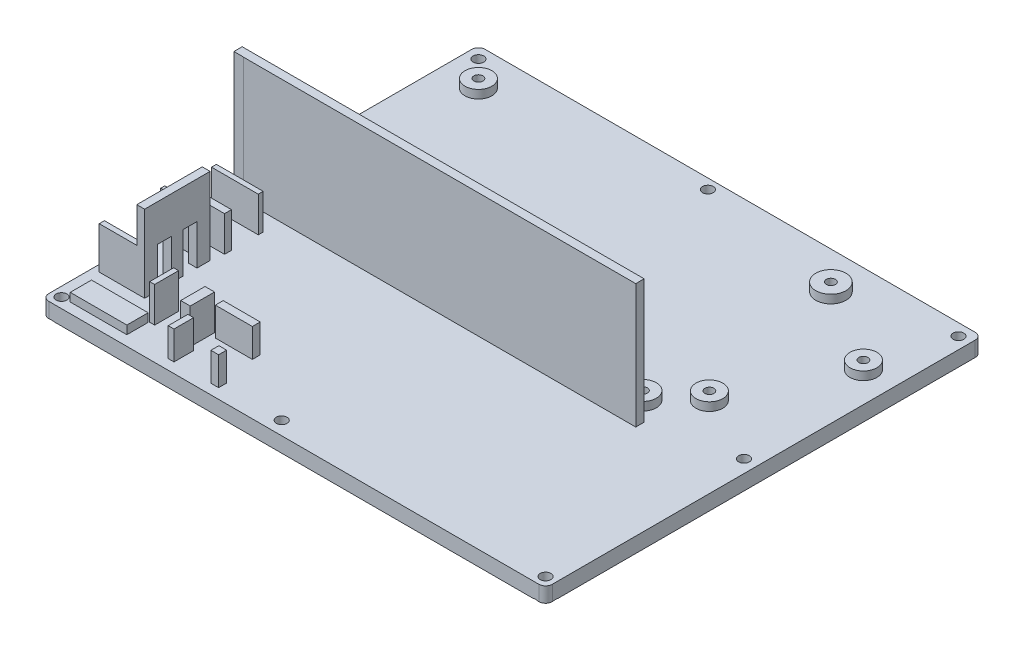
from build123d import *

# Parameters (mm, degrees)
SKETCH1_W            = 150
SKETCH1_H            = 130
BOSS_EXTRUDE1_DEPTH  = 2.5
SKETCH2_W            = 150
SKETCH2_H            = 130
BOSS_EXTRUDE2_DEPTH  = 2
SKETCH3_W            = 2.5
SKETCH3_H            = 16.780539685
BOSS_EXTRUDE3_DEPTH  = 12
SKETCH4_W            = 6.999579775
SKETCH4_H            = 4.214800725
SKETCH4_W_2          = 6.547993983
SKETCH4_H_2          = 4.177168575
CUT_EXTRUDE1_DEPTH   = 12
SKETCH5_W            = 13.520958653
SKETCH5_H            = 1.542676049
SKETCH5_H_2          = 1.182146985
BOSS_EXTRUDE4_DEPTH  = 12.5
SKETCH6_W            = 16.86645729
SKETCH6_H            = 7.123900825
BOSS_EXTRUDE5_DEPTH  = 2.5
SKETCH7_W            = 13.933318375
SKETCH7_H            = 1.459493224
SKETCH7_H_2          = 2.069451468
BOSS_EXTRUDE6_DEPTH  = 10.5
SKETCH8_W            = 1.465633043
SKETCH8_H            = 7.120231944
SKETCH8_W_2          = 2.837736244
SKETCH8_H_2          = 7.249129709
BOSS_EXTRUDE8_DEPTH  = 10.5
SKETCH9_W            = 11.026219754
SKETCH9_H            = 2.333193258
SKETCH9_W_2          = 2.290453933
SKETCH9_H_2          = 3.041515947
SKETCH9_W_3          = 1.716125118
SKETCH9_H_3          = 6.956645693
BOSS_EXTRUDE9_DEPTH  = 8.5
SKETCH10_W           = 64.150572822
SKETCH10_H           = 1.749214845
CUT_EXTRUDE2_DEPTH   = 22
SKETCH11_R           = 4
SKETCH11_R_2         = 4.5
BOSS_EXTRUDE10_DEPTH = 2.5
SKETCH12_R           = 1.35
CUT_EXTRUDE3_DEPTH   = 5
SKETCH13_R           = 1.6
CUT_EXTRUDE4_DEPTH   = 9
CHAMFER1_SIZE        = 1.5
FILLET1_R            = 2
SKETCH14_W           = 2.326153497
SKETCH14_H           = 19.505362719
BOSS_EXTRUDE11_DEPTH = 11
SKETCH15_W           = 116.835015105
SKETCH15_H           = 2.5
BOSS_EXTRUDE12_DEPTH = 37
SKETCH16_W           = 2.915269742
SKETCH16_H           = 2.460041161
BOSS_EXTRUDE13_DEPTH = 33


with BuildPart() as part:
    # Sketch1 → Boss-Extrude1 (new body)
    with BuildSketch(Plane(origin=(0, 0, 0), x_dir=(1, 0, 0), z_dir=(0, 1, 0))):
        with Locations((10.867486339, -10.655737705)):
            Rectangle(SKETCH1_W, SKETCH1_H)
    extrude(amount=BOSS_EXTRUDE1_DEPTH)

    # Sketch2 → Boss-Extrude2 (add)
    with BuildSketch(Plane.XZ):
        with Locations((10.867486339, 10.655737705)):
            Rectangle(SKETCH2_W, SKETCH2_H)
    extrude(amount=BOSS_EXTRUDE2_DEPTH)

    # Sketch3 → Boss-Extrude3 (add)
    with BuildSketch(Plane(origin=(0, 2.5, 0), x_dir=(1, 0, 0), z_dir=(0, 1, 0))):
        with Locations((-49.882513661, -50.670528215)):
            Rectangle(SKETCH3_W, SKETCH3_H)
    extrude(amount=BOSS_EXTRUDE3_DEPTH)

    # Sketch4 → Cut-Extrude1 (cut)
    with BuildSketch(Plane(origin=(0, 14.5, 0), x_dir=(1, 0, 0), z_dir=(0, 1, 0))):
        with Locations((-49.30282547, -47.109594286)):
            Rectangle(SKETCH4_W, SKETCH4_H)
        with Locations((-49.077032574, -54.692472376)):
            Rectangle(SKETCH4_W_2, SKETCH4_H_2)
    extrude(amount=-CUT_EXTRUDE1_DEPTH, mode=Mode.SUBTRACT)

    # Sketch5 → Boss-Extrude4 (add)
    with BuildSketch(Plane(origin=(0, 2.5, 0), x_dir=(1, 0, 0), z_dir=(0, 1, 0))):
        with Locations((-55.392992988, -59.832136082)):
            Rectangle(SKETCH5_W, SKETCH5_H)
        with Locations((-55.392992988, -41.68918488)):
            Rectangle(SKETCH5_W, SKETCH5_H_2)
    extrude(amount=BOSS_EXTRUDE4_DEPTH)

    # Sketch6 → Boss-Extrude5 (add)
    with BuildSketch(Plane(origin=(0, 2.5, 0), x_dir=(1, 0, 0), z_dir=(0, 1, 0))):
        with Locations((-50.314672673, -69.866817827)):
            Rectangle(SKETCH6_W, SKETCH6_H)
    extrude(amount=BOSS_EXTRUDE5_DEPTH)

    # Sketch7 → Boss-Extrude6 (add)
    with BuildSketch(Plane(origin=(0, 2.5, 0), x_dir=(1, 0, 0), z_dir=(0, 1, 0))):
        with Locations((-55.033530113, -26.576664837)):
            Rectangle(SKETCH7_W, SKETCH7_H)
        with Locations((-55.033530113, -36.325889274)):
            Rectangle(SKETCH7_W, SKETCH7_H_2)
    extrude(amount=BOSS_EXTRUDE6_DEPTH)

    # Sketch8 → Boss-Extrude8 (add)
    with BuildSketch(Plane(origin=(0, 2.5, 0), x_dir=(1, 0, 0), z_dir=(0, 1, 0))):
        with Locations((-40.946126135, -62.470830958)):
            Rectangle(SKETCH8_W, SKETCH8_H)
        with Locations((-30.762507723, -62.68030256)):
            Rectangle(SKETCH8_W_2, SKETCH8_H_2)
    extrude(amount=BOSS_EXTRUDE8_DEPTH)

    # Sketch9 → Boss-Extrude9 (add)
    with BuildSketch(Plane(origin=(0, 2.5, 0), x_dir=(1, 0, 0), z_dir=(0, 1, 0))):
        with Locations((-22.326370107, -59.157602986)):
            Rectangle(SKETCH9_W, SKETCH9_H)
        with Locations((-15.699052952, -71.779845012)):
            Rectangle(SKETCH9_W_2, SKETCH9_H_2)
        with Locations((-28.697542543, -70.271634632)):
            Rectangle(SKETCH9_W_3, SKETCH9_H_3)
    extrude(amount=BOSS_EXTRUDE9_DEPTH)

    # Sketch10 → Cut-Extrude2 (cut)
    with BuildSketch(Plane(origin=(0, 2.5, 0), x_dir=(1, 0, 0), z_dir=(0, 1, 0))):
        with Locations((-28.662922823, -73.523219452)):
            Rectangle(SKETCH10_W, SKETCH10_H)
    extrude(amount=CUT_EXTRUDE2_DEPTH, mode=Mode.SUBTRACT)

    # Sketch11 → Boss-Extrude10 (add)
    with BuildSketch(Plane(origin=(0, 2.5, 0), x_dir=(1, 0, 0), z_dir=(0, 1, 0))):
        with Locations(Location((61.867486339, -2.855737705, 0), (0, 0, 270))):
            Circle(SKETCH11_R)
        with Locations(Location((76.867486339, 28.044262295, 0), (0, 0, 270))):
            Circle(SKETCH11_R)
        with Locations(Location((51.867486339, 43.344262295, 0), (0, 0, 270))):
            Circle(SKETCH11_R_2)
        with Locations(Location((51.867486339, -12.655737705, 0), (0, 0, 270))):
            Circle(SKETCH11_R)
        with Locations(Location((-53.132513661, -12.655737705, 0), (0, 0, 270))):
            Circle(SKETCH11_R)
        with Locations(Location((-53.132513661, 43.344262295, 0), (0, 0, 270))):
            Circle(SKETCH11_R)
    extrude(amount=BOSS_EXTRUDE10_DEPTH)

    # Sketch12 → Cut-Extrude3 (cut)
    with BuildSketch(Plane(origin=(0, 5, 0), x_dir=(1, 0, 0), z_dir=(0, 1, 0))):
        with Locations(Location((-53.208473164, -12.731303325, 0), (0, 0, 270))):
            Circle(SKETCH12_R)
        with Locations(Location((-53.132513661, 43.344262295, 0), (0, 0, 270))):
            Circle(SKETCH12_R)
        with Locations(Location((51.867486339, 43.344262295, 0), (0, 0, 270))):
            Circle(SKETCH12_R)
        with Locations(Location((51.867486339, -12.655737705, 0), (0, 0, 270))):
            Circle(SKETCH12_R)
        with Locations(Location((61.867486339, -2.855737705, 0), (0, 0, 270))):
            Circle(SKETCH12_R)
        with Locations(Location((76.867486339, 28.044262295, 0), (0, 0, 270))):
            Circle(SKETCH12_R)
    extrude(amount=-CUT_EXTRUDE3_DEPTH, mode=Mode.SUBTRACT)

    # Sketch13 → Cut-Extrude4 (cut)
    with BuildSketch(Plane.XZ.offset(2)):
        with Locations(Location((-61.332513661, 72.655737705, 0), (0, 0, 270))):
            Circle(SKETCH13_R)
        with Locations(Location((3.254378963, 71.655737705, 0), (0, 0, 270))):
            Circle(SKETCH13_R)
        with Locations(Location((82.867486339, 72.655737705, 0), (0, 0, 270))):
            Circle(SKETCH13_R)
        with Locations(Location((82.367486339, -50.844262295, 0), (0, 0, 270))):
            Circle(SKETCH13_R)
        with Locations(Location((-60.632513661, -50.844262295, 0), (0, 0, 270))):
            Circle(SKETCH13_R)
        with Locations(Location((7.222931356, -51.344262295, 0), (0, 0, 270))):
            Circle(SKETCH13_R)
        with Locations(Location((-60.132513661, 21.175451705, 0), (0, 0, 270))):
            Circle(SKETCH13_R)
        with Locations(Location((82.055017687, 12.739317464, 0), (0, 0, 270))):
            Circle(SKETCH13_R)
    extrude(amount=-CUT_EXTRUDE4_DEPTH, mode=Mode.SUBTRACT)

    # Chamfer1
    # the kernel refuses this chamfer: 1.5 mm, written as the material it takes off along each edge
    with BuildSketch(Plane(origin=(3.254378963, -2, 71.655737705), x_dir=(0, 0, -1), z_dir=(-1, 0, 0))) as chamfer1_piece_1:
        Polygon((1.6 + CHAMFER1_SIZE, 0), (1.6, -CHAMFER1_SIZE), (1.6, 0), align=None)
    revolve(axis=Axis((3.254378963, -2, 71.655737705), (0, -1, 0)), mode=Mode.SUBTRACT)
    with BuildSketch(Plane(origin=(82.867486339, -2, 72.655737705), x_dir=(0, 0, -1), z_dir=(-1, 0, 0))) as chamfer1_piece_2:
        Polygon((1.6 + CHAMFER1_SIZE, 0), (1.6, -CHAMFER1_SIZE), (1.6, 0), align=None)
    revolve(axis=Axis((82.867486339, -2, 72.655737705), (0, -1, 0)), mode=Mode.SUBTRACT)
    with BuildSketch(Plane(origin=(82.367486339, -2, -50.844262295), x_dir=(0, 0, -1), z_dir=(-1, 0, 0))) as chamfer1_piece_3:
        Polygon((1.6 + CHAMFER1_SIZE, 0), (1.6, -CHAMFER1_SIZE), (1.6, 0), align=None)
    revolve(axis=Axis((82.367486339, -2, -50.844262295), (0, -1, 0)), mode=Mode.SUBTRACT)
    with BuildSketch(Plane(origin=(-60.632513661, -2, -50.844262295), x_dir=(0, 0, -1), z_dir=(-1, 0, 0))) as chamfer1_piece_4:
        Polygon((1.6 + CHAMFER1_SIZE, 0), (1.6, -CHAMFER1_SIZE), (1.6, 0), align=None)
    revolve(axis=Axis((-60.632513661, -2, -50.844262295), (0, -1, 0)), mode=Mode.SUBTRACT)
    with BuildSketch(Plane(origin=(7.222931356, -2, -51.344262295), x_dir=(0, 0, -1), z_dir=(-1, 0, 0))) as chamfer1_piece_5:
        Polygon((1.6 + CHAMFER1_SIZE, 0), (1.6, -CHAMFER1_SIZE), (1.6, 0), align=None)
    revolve(axis=Axis((7.222931356, -2, -51.344262295), (0, -1, 0)), mode=Mode.SUBTRACT)
    with BuildSketch(Plane(origin=(-60.132513661, -2, 21.175451705), x_dir=(0, 0, -1), z_dir=(-1, 0, 0))) as chamfer1_piece_6:
        Polygon((1.6 + CHAMFER1_SIZE, 0), (1.6, -CHAMFER1_SIZE), (1.6, 0), align=None)
    revolve(axis=Axis((-60.132513661, -2, 21.175451705), (0, -1, 0)), mode=Mode.SUBTRACT)
    with BuildSketch(Plane(origin=(82.055017687, -2, 12.739317464), x_dir=(0, 0, -1), z_dir=(-1, 0, 0))) as chamfer1_piece_7:
        Polygon((1.6 + CHAMFER1_SIZE, 0), (1.6, -CHAMFER1_SIZE), (1.6, 0), align=None)
    revolve(axis=Axis((82.055017687, -2, 12.739317464), (0, -1, 0)), mode=Mode.SUBTRACT)
    with BuildSketch(Plane(origin=(-61.332513661, -2, 72.655737705), x_dir=(0, 0, -1), z_dir=(-1, 0, 0))) as chamfer1_piece_8:
        Polygon((1.6 + CHAMFER1_SIZE, 0), (1.6, -CHAMFER1_SIZE), (1.6, 0), align=None)
    revolve(axis=Axis((-61.332513661, -2, 72.655737705), (0, -1, 0)), mode=Mode.SUBTRACT)

    # Fillet1
    # the kernel refuses this fillet: 2 mm, written as the material it takes off along each edge
    with BuildSketch(Plane(origin=(-64.132513661, -7, -54.344262295), x_dir=(1, 0, 0), z_dir=(0, 1, 0)), Plane(origin=(85.867486339, 7.5, -54.344262295), x_dir=(-1, 0, 0), z_dir=(0, -1, 0)), Plane(origin=(85.867486339, 7.5, 75.655737705), x_dir=(0, 0, -1), z_dir=(0, -1, 0)), Plane(origin=(-64.132513661, -7, 75.655737705), x_dir=(0, 0, -1), z_dir=(0, 1, 0))) as fillet1_piece_1:
        with BuildLine():
            CenterArc((FILLET1_R, -FILLET1_R), FILLET1_R, 90, 90)
            Line((0, -FILLET1_R), (0, 0))
            Line((0, 0), (FILLET1_R, 0))
        make_face()
    extrude(amount=14.5, mode=Mode.SUBTRACT)

    # Sketch14 → Boss-Extrude11 (add)
    with BuildSketch(Plane(origin=(0, 14.5, 0), x_dir=(1, 0, 0), z_dir=(0, 1, 0))):
        with Locations((-49.79559041, -50.850792747)):
            Rectangle(SKETCH14_W, SKETCH14_H)
    extrude(amount=BOSS_EXTRUDE11_DEPTH)

    # Sketch15 → Boss-Extrude12 (add)
    with BuildSketch(Plane(origin=(0, 2.5, 0), x_dir=(1, 0, 0), z_dir=(0, 1, 0))):
        with Locations((-0.676686853, -19.412678434)):
            Rectangle(SKETCH15_W, SKETCH15_H)
    extrude(amount=BOSS_EXTRUDE12_DEPTH)

    # Sketch16 → Boss-Extrude13 (add)
    with BuildSketch(Plane(origin=(0, 39.5, 0), x_dir=(1, 0, 0), z_dir=(0, 1, 0))):
        with Locations((-60.551829276, -19.392699014)):
            Rectangle(SKETCH16_W, SKETCH16_H)
    extrude(amount=-BOSS_EXTRUDE13_DEPTH)


solid = part.part
